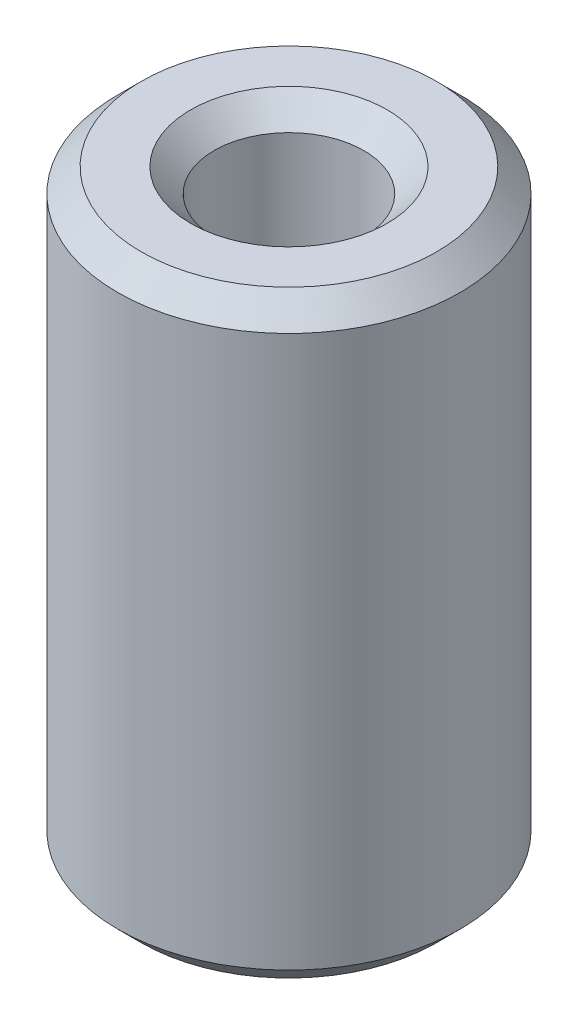
from build123d import *

# Parameters (mm, degrees)
SKETCH1_R           = 27.5
BOSS_EXTRUDE1_DEPTH = 96.111597299
SKETCH2_R           = 12.023985628
CUT_EXTRUDE1_DEPTH  = 104.681913251
CHAMFER1_SIZE       = 3.774537352


with BuildPart() as part:
    # Sketch1 → Boss-Extrude1 (new body)
    with BuildSketch(Plane(origin=(0, 0, 0), x_dir=(1, 0, 0), z_dir=(0, 1, 0))):
        Circle(SKETCH1_R)
    extrude(amount=BOSS_EXTRUDE1_DEPTH)

    # Sketch2 → Cut-Extrude1 (cut, through all)
    with BuildSketch(Plane(origin=(0, 0, 0), x_dir=(1, 0, 0), z_dir=(0, 1, 0))):
        Circle(SKETCH2_R)
    extrude(amount=CUT_EXTRUDE1_DEPTH, mode=Mode.SUBTRACT)

    # Chamfer1
    chamfer1_edges = [part.edges().sort_by_distance(p)[0] for p in [
        (-12.023985628, 96.111597299, 0),
        (-12.023985628, 0, 0),
        (-27.5, 0, 0),
        (-27.5, 96.111597299, 0),
    ]]
    chamfer(chamfer1_edges, length=CHAMFER1_SIZE)


solid = part.part
